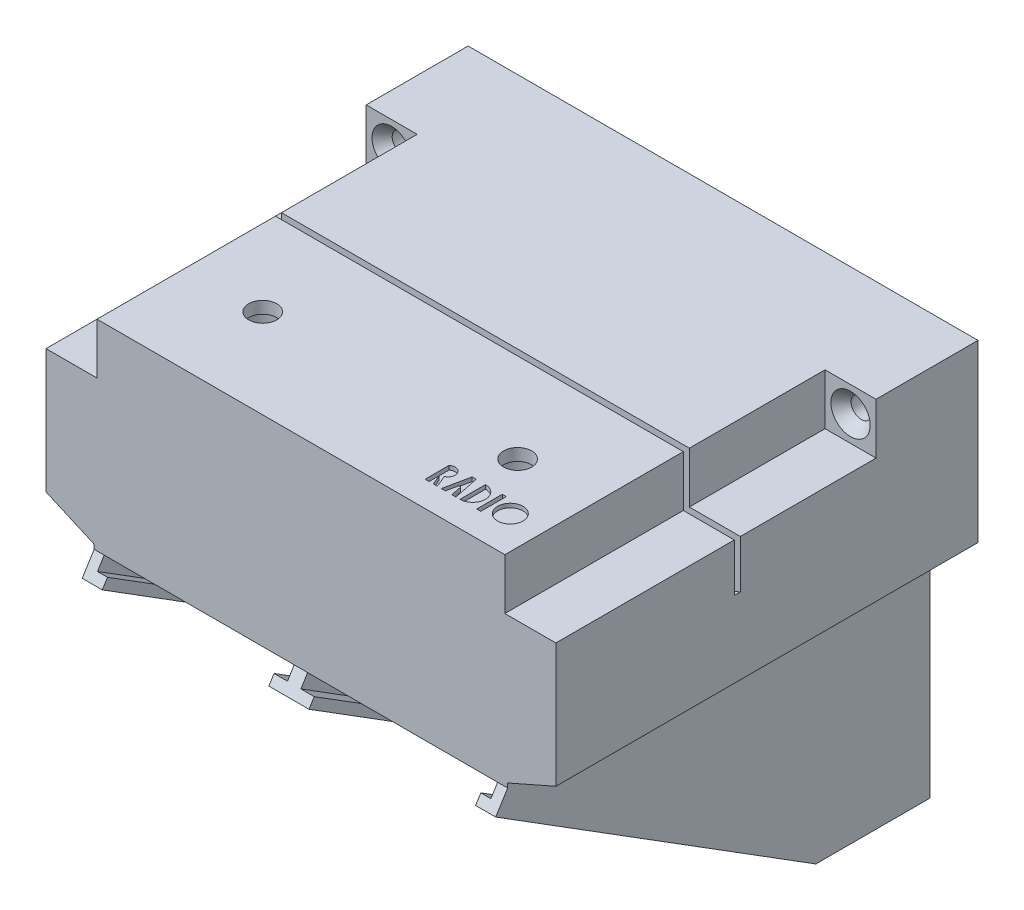
from build123d import *

# Parameters (mm, degrees)
BOSS_EXTRU_1_DEPTH                                = 59.2
BOSS_EXTRU_2_DEPTH                                = 1.5
BOSS_EXTRU_3_DEPTH                                = 44.45
ESQUISSE5_W                                       = 98
ESQUISSE5_H                                       = 50
ENL_V_MAT_EXTRU_1_DEPTH                           = 79.75
NERVURE3_REACH                                    = 219.919
ESQUISSE7_WALL_W                                  = 531.966109146
ESQUISSE7_WALL_H                                  = 10
ESQUISSE8_W                                       = 12.7
ESQUISSE8_H                                       = 12.7
ENL_V_MAT_EXTRU_2_DEPTH                           = 79.75
FRAISAGE_POUR_VIS_T_TE_FRAIS_E_BOMB_E_D           = 5.1054
FRAISAGE_POUR_VIS_T_TE_FRAIS_E_BOMB_E_CSINK_D     = 9.779
FRAISAGE_POUR_VIS_T_TE_FRAIS_E_BOMB_E_CSINK_ANGLE = 82
ENL_VEMENT_START                                  = 1.582341914
ENL_VEMENT_DE_MATI_RE_BALAYAGE2_OUTLINE_R         = 6.35
ENL_VEMENT_DE_MATI_RE_BALAYAGE2_DEPTH             = 71.529963189
ENL_VEMENT_START_2                                = -14.345570266
ENL_VEMENT_DE_MATI_RE_BALAYAGE3_OUTLINE_R         = 6.35
ENL_VEMENT_DE_MATI_RE_BALAYAGE3_DEPTH             = 71.529963189
ESQUISSE26_R                                      = 6.35
ENL_V_MAT_EXTRU_4_DEPTH                           = 3.175
NERVURE4_REACH                                    = 258.559
ESQUISSE27_WALL_W                                 = 609.246066174
ESQUISSE27_WALL_H                                 = 2.5
ESQUISSE29_R                                      = 3.5
ENL_V_MAT_EXTRU_7_DEPTH                           = 257.559080586
ESQUISSE28_R                                      = 5.55625
ENL_V_MAT_EXTRU_6_DEPTH                           = 47
ESQUISSE30_R                                      = 3.175
LETTRE_O_DEPTH                                    = 1
ESQUISSE31_W                                      = 1
ESQUISSE31_H                                      = 6.35
LETTRE_I_DEPTH                                    = 1
LETTRE_D_DEPTH                                    = 1
LETTRE_A_DEPTH                                    = 1
LETTRE_R_DEPTH                                    = 1
BOSS_EXTRU_5_REACH                                = 258.559
BOSS_EXTRU_6_DEPTH                                = 94.127905
BOSS_EXTRU_7_DEPTH                                = 2.5
ESQUISSE38_W                                      = 2.5
ESQUISSE38_H                                      = 2.446117838
BOSS_EXTRU_8_DEPTH                                = 94.127905
ENL_V_MAT_EXTRU_13_REACH                          = 263.075
BOSS_EXTRU_9_REACH                                = 245.841
ESQUISSE40_W                                      = 2.5
ESQUISSE40_H                                      = 105.15
ENL_V_MAT_EXTRU_14_REACH                          = 258.559


# Read off the part's stored shape, not the designer's step: Enlèvement de matière-Balayage2, Enlèvement de matière-Balayage3
with BuildPart() as part:
    # Esquisse2 → Boss.-Extru.1 (new body)
    with BuildSketch(Plane.XY):
        Polygon((0, 0), (98, 0), (98, 50), (211.579865137, 100), (-113.579865137, 100), (0, 50), align=None)
    extrude(amount=BOSS_EXTRU_1_DEPTH)

    # Esquisse3 → Boss.-Extru.2 (add)
    with BuildSketch(Plane.XY.offset(59.2)):
        Polygon((0, 0), (98, 0), (98, 50), (211.579865137, 100), (168.51775825, 100), (92.873568069, 66.7), (5.126431931, 66.7), (-70.51775825, 100), (-113.579865137, 100), (0, 50), align=None)
    extrude(amount=BOSS_EXTRU_2_DEPTH)

    # Esquisse4 → Boss.-Extru.3 (add)
    with BuildSketch(Plane.XY.offset(60.7)):
        Polygon((0, 0), (98, 0), (98, 50), (211.579865137, 100), (-113.579865137, 100), (0, 50), align=None)
    extrude(amount=BOSS_EXTRU_3_DEPTH)

    # Esquisse5 → Enlèv. mat.-Extru.1 (cut)
    with BuildSketch(Plane.XY.offset(105.15)):
        with Locations((49, 25)):
            Rectangle(ESQUISSE5_W, ESQUISSE5_H)
    extrude(amount=-ENL_V_MAT_EXTRU_1_DEPTH, mode=Mode.SUBTRACT)

    # Esquisse7 wall → Nervure3 (add, up to next)
    with BuildSketch(Plane(origin=(49, 25, 65.275), x_dir=(0, -0.531192105031, -0.847251407525), z_dir=(0, 0.847251407525, -0.531192105031)), mode=Mode.PRIVATE) as nervure3_sk1:
        Rectangle(ESQUISSE7_WALL_W, ESQUISSE7_WALL_H)
    nervure3_tool1 = extrude(nervure3_sk1.sketch, amount=NERVURE3_REACH, mode=Mode.PRIVATE) - part.part
    add(nervure3_tool1.solids().sort_by_distance((49, 25, 65.275))[0])

    # Esquisse8 → Enlèv. mat.-Extru.2 (cut)
    with BuildSketch(Plane.XY.offset(105.15)):
        with Locations((-8.15, 93.65)):
            Rectangle(ESQUISSE8_W, ESQUISSE8_H)
    enl_v_mat_extru_2 = extrude(amount=-ENL_V_MAT_EXTRU_2_DEPTH, mode=Mode.SUBTRACT)

    # Symétrie1: Enlèv. mat.-Extru.2 across plane
    add(enl_v_mat_extru_2.mirror(Plane(origin=(49, 0, 0), x_dir=(0, 0, 1), z_dir=(1, 0, 0))), mode=Mode.SUBTRACT)

    # Fraisage pour vis à tête fraisée bombée #101 (through all)
    with Locations(Plane.XY.offset(25.4)):
        with Locations((22, 25), (76, 25), (106.15, 93.65), (-8.15, 93.65)):
            CounterSinkHole(FRAISAGE_POUR_VIS_T_TE_FRAIS_E_BOMB_E_D / 2, FRAISAGE_POUR_VIS_T_TE_FRAIS_E_BOMB_E_CSINK_D / 2, counter_sink_angle=FRAISAGE_POUR_VIS_T_TE_FRAIS_E_BOMB_E_CSINK_ANGLE)

    # Enlèvement de matière-Balayage2 outline → Enlèvement de matière-Balayage2 (cut)
    with BuildSketch(Plane(origin=(0, 0, 0), x_dir=(0.8002544678430299, -0.3970882953901229, 0.44934805258444765), z_dir=(0.5996605595645498, 0.5299192642332058, -0.5996605595645498)).offset(ENL_VEMENT_START)):
        with Locations((6.44062437, -61.833135415)):
            Circle(ENL_VEMENT_DE_MATI_RE_BALAYAGE2_OUTLINE_R)
    extrude(amount=ENL_VEMENT_DE_MATI_RE_BALAYAGE2_DEPTH, mode=Mode.SUBTRACT)

    # Enlèvement de matière-Balayage3 outline → Enlèvement de matière-Balayage3 (cut)
    with BuildSketch(Plane(origin=(0, 0, 0), x_dir=(0.8002544678430281, 0.39708829539012125, -0.4493480525844523), z_dir=(0.5996605595645522, -0.5299192642332002, 0.5996605595645522)).offset(ENL_VEMENT_START_2)):
        with Locations((71.984313478, 61.833135415)):
            Circle(ENL_VEMENT_DE_MATI_RE_BALAYAGE3_OUTLINE_R)
    extrude(amount=ENL_VEMENT_DE_MATI_RE_BALAYAGE3_DEPTH, mode=Mode.SUBTRACT)

    # Esquisse26 → Enlèv. mat.-Extru.4 (cut)
    with BuildSketch(Plane(origin=(0, 0, 0), x_dir=(-1, 0, 0), z_dir=(0, 0, -1))):
        with Locations((-49, 82.52)):
            Circle(ESQUISSE26_R)
    extrude(amount=-ENL_V_MAT_EXTRU_4_DEPTH, mode=Mode.SUBTRACT)

    # Esquisse27 wall → Nervure4 (add, up to next)
    with BuildSketch(Plane(origin=(0, 25, 65.275), x_dir=(0, 0.531192105031, 0.847251407525), z_dir=(0, 0.847251407525, -0.531192105031)), mode=Mode.PRIVATE) as nervure4_sk1:
        with Locations((0, 1.25)):
            Rectangle(ESQUISSE27_WALL_W, ESQUISSE27_WALL_H)
    nervure4_tool1 = extrude(nervure4_sk1.sketch, amount=NERVURE4_REACH, mode=Mode.PRIVATE) - part.part
    nervure4 = nervure4_tool1.solids().sort_by_distance((0, 25, 65.275))[0]
    add(nervure4)

    # Symétrie5: Nervure4 across plane
    add(nervure4.mirror(Plane.ZY.offset(-49)))

    # Esquisse29 → Enlèv. mat.-Extru.7 (cut, through all)
    with BuildSketch(Plane(origin=(0, 100, 0), x_dir=(1, 0, 0), z_dir=(0, 1, 0))):
        with Locations(Location((80.75, -82.925, 0), (0, 0, 180))):
            Circle(ESQUISSE29_R)
        with Locations(Location((17.25, -82.925, 0), (0, 0, 180))):
            Circle(ESQUISSE29_R)
    extrude(amount=-ENL_V_MAT_EXTRU_7_DEPTH, mode=Mode.SUBTRACT)

    # Esquisse28 → Enlèv. mat.-Extru.6 (cut)
    with BuildSketch(Plane.XZ.offset(-50)):
        with Locations(Location((17.25, 82.925, 0), (0, 0, 270))):
            Circle(ESQUISSE28_R)
        with Locations(Location((80.75, 82.925, 0), (0, 0, 270))):
            Circle(ESQUISSE28_R)
    extrude(amount=-ENL_V_MAT_EXTRU_6_DEPTH, mode=Mode.SUBTRACT)

    # Esquisse30 → Lettre_O (cut)
    with BuildSketch(Plane(origin=(0, 100, 0), x_dir=(1, 0, 0), z_dir=(0, 1, 0))):
        with Locations(Location((91.625, -95.625, 0), (0, 0, 180))):
            Circle(ESQUISSE30_R)
    extrude(amount=-LETTRE_O_DEPTH, mode=Mode.SUBTRACT)

    # Esquisse31 → Lettre_I (cut)
    with BuildSketch(Plane(origin=(0, 100, 0), x_dir=(1, 0, 0), z_dir=(0, 1, 0))):
        with Locations((86.95, -95.625)):
            Rectangle(ESQUISSE31_W, ESQUISSE31_H)
    extrude(amount=-LETTRE_I_DEPTH, mode=Mode.SUBTRACT)

    # Esquisse32 → Lettre_D (cut)
    with BuildSketch(Plane(origin=(0, 100, 0), x_dir=(1, 0, 0), z_dir=(0, 1, 0))):
        with BuildLine():
            Line((82.275, -92.45), (82.275, -98.8))
            ThreePointArc((82.275, -98.8), (85.45, -95.625), (82.275, -92.45))
        make_face()
    extrude(amount=-LETTRE_D_DEPTH, mode=Mode.SUBTRACT)

    # Esquisse33 → Lettre_A (cut)
    with BuildSketch(Plane(origin=(0, 100, 0), x_dir=(1, 0, 0), z_dir=(0, 1, 0))):
        Polygon((77.629166667, -98.8), (78.629166667, -98.8), (79.202083333, -96.05), (79.702083333, -96.05), (80.275, -98.8), (81.275, -98.8), (79.952083333, -92.45), (78.952083333, -92.45), align=None)
    extrude(amount=-LETTRE_A_DEPTH, mode=Mode.SUBTRACT)

    # Esquisse34 → Lettre_R (cut)
    with BuildSketch(Plane(origin=(0, 100, 0), x_dir=(1, 0, 0), z_dir=(0, 1, 0))):
        with BuildLine():
            Line((73.593632761, -98.8), (73.593632761, -92.863864698))
            ThreePointArc((73.593632761, -92.863864698), (76.218088657, -93.289201214), (75.393480286, -95.816789182))
            Line((75.393480286, -95.816789182), (76.629166667, -98.8))
            Line((76.629166667, -98.8), (75.629166667, -98.8))
            Line((75.629166667, -98.8), (74.593632761, -96.3))
            Line((74.593632761, -96.3), (74.593632761, -98.8))
            Line((74.593632761, -98.8), (73.593632761, -98.8))
        make_face()
    extrude(amount=-LETTRE_R_DEPTH, mode=Mode.SUBTRACT)

    # Boss.-Extru.5: up to this face of the body (flat: up to its plane)
    boss_extru_5_end = Plane(part.part.faces().sort_by_distance((98, 30.090642155, 36.697287119))[0])
    # Esquisse35 → Boss.-Extru.5 (add, up to the picked face)
    with BuildSketch(Plane.ZY, mode=Mode.PRIVATE) as boss_extru_5_sk1:
        Polygon((25.4, 0), (28.385893417, -4.7625), (0, -4.7625), (0, 0), align=None)
    boss_extru_5_tool1 = split(extrude(boss_extru_5_sk1.sketch, amount=-BOSS_EXTRU_5_REACH, mode=Mode.PRIVATE), bisect_by=boss_extru_5_end, keep=Keep.BOTH, mode=Mode.PRIVATE)
    add(boss_extru_5_tool1.solids().sort_by(Axis((0, -2.425315, 13.460287), (1, 0, 0)))[0])

    # Esquisse36 → Boss.-Extru.6 (add)
    with BuildSketch(Plane(origin=(0, 11.43135277, 18.233007668), x_dir=(1, 0, 0), z_dir=(0, 0.5311921050311518, 0.8472514075246933))):
        Polygon((50.67, -13.492279468), (50.67, -16.667279468), (54, -16.667279468), (54, -19.113397306), (44, -19.113397306), (44, -16.667279468), (47.33, -16.667279468), (47.33, -13.492279468), align=None)
    extrude(amount=BOSS_EXTRU_6_DEPTH)

    # Esquisse37 → Boss.-Extru.7 (add)
    with BuildSketch(Plane(origin=(98, 0, 0), x_dir=(0, 0, -1), z_dir=(1, 0, 0))):
        Polygon((0, 50), (0, -4.7625), (-28.385893417, -4.7625), (-115.732080917, 50), align=None)
    boss_extru_7 = extrude(amount=BOSS_EXTRU_7_DEPTH)

    # Esquisse38 → Boss.-Extru.8 (add)
    with BuildSketch(Plane(origin=(0, 11.43135277, 18.233007668), x_dir=(1, 0, 0), z_dir=(0, 0.5311921050311518, 0.8472514075246933))):
        with Locations((96.75, -17.890338387)):
            Rectangle(ESQUISSE38_W, ESQUISSE38_H)
    boss_extru_8 = extrude(amount=BOSS_EXTRU_8_DEPTH)

    # Esquisse39 → Enlèv. mat.-Extru.13 (cut, up to next)
    with BuildSketch(Plane.ZY.offset(-98), mode=Mode.PRIVATE) as enl_v_mat_extru_13_sk1:
        Polygon((108.135893417, 45.2375), (105.15, 50), (115.732080917, 50), align=None)
    enl_v_mat_extru_13_tool1 = extrude(enl_v_mat_extru_13_sk1.sketch, amount=-ENL_V_MAT_EXTRU_13_REACH, mode=Mode.PRIVATE) & part.part
    enl_v_mat_extru_13 = enl_v_mat_extru_13_tool1.solids().sort_by_distance((98, 48.4125, 109.672658))[0]
    add(enl_v_mat_extru_13, mode=Mode.SUBTRACT)

    # Esquisse40 → Boss.-Extru.9 (add, up to next)
    with BuildSketch(Plane(origin=(0, 50, 0), x_dir=(1, 0, 0), z_dir=(0, 1, 0)), mode=Mode.PRIVATE) as boss_extru_9_sk1:
        with Locations((99.25, -52.575)):
            Rectangle(ESQUISSE40_W, ESQUISSE40_H)
    boss_extru_9_tool1 = extrude(boss_extru_9_sk1.sketch, amount=BOSS_EXTRU_9_REACH, mode=Mode.PRIVATE) - part.part
    boss_extru_9 = boss_extru_9_tool1.solids().sort_by_distance((99.25, 50, 52.575))[0]
    add(boss_extru_9)

    # Symétrie6: Boss.-Extru.7, Boss.-Extru.8, Enlèv. mat.-Extru.13, Boss.-Extru.9 across plane
    add(boss_extru_7.mirror(Plane.ZY.offset(-49)))
    add(boss_extru_8.mirror(Plane.ZY.offset(-49)))
    add(enl_v_mat_extru_13.mirror(Plane.ZY.offset(-49)), mode=Mode.SUBTRACT)
    add(boss_extru_9.mirror(Plane.ZY.offset(-49)))

    # Esquisse41 → Enlèv. mat.-Extru.14 (cut, up to next)
    with BuildSketch(Plane.XY.offset(105.15), mode=Mode.PRIVATE) as enl_v_mat_extru_14_sk1:
        Polygon((112.5, 100), (112.5, 56.38317363), (211.579865137, 100), align=None)
    enl_v_mat_extru_14_tool1 = extrude(enl_v_mat_extru_14_sk1.sketch, amount=-ENL_V_MAT_EXTRU_14_REACH, mode=Mode.PRIVATE) & part.part
    # Esquisse41 → Enlèv. mat.-Extru.14 (cut, up to next)
    with BuildSketch(Plane.XY.offset(105.15), mode=Mode.PRIVATE) as enl_v_mat_extru_14_sk2:
        Polygon((-14.5, 100), (-14.5, 56.38317363), (-113.579865137, 100), align=None)
    enl_v_mat_extru_14_tool2 = extrude(enl_v_mat_extru_14_sk2.sketch, amount=-ENL_V_MAT_EXTRU_14_REACH, mode=Mode.PRIVATE) & part.part
    add(enl_v_mat_extru_14_tool1.solids().sort_by_distance((145.526622, 85.461058, 105.15))[0], mode=Mode.SUBTRACT)
    add(enl_v_mat_extru_14_tool2.solids().sort_by_distance((-47.526622, 85.461058, 105.15))[0], mode=Mode.SUBTRACT)


solid = part.part
